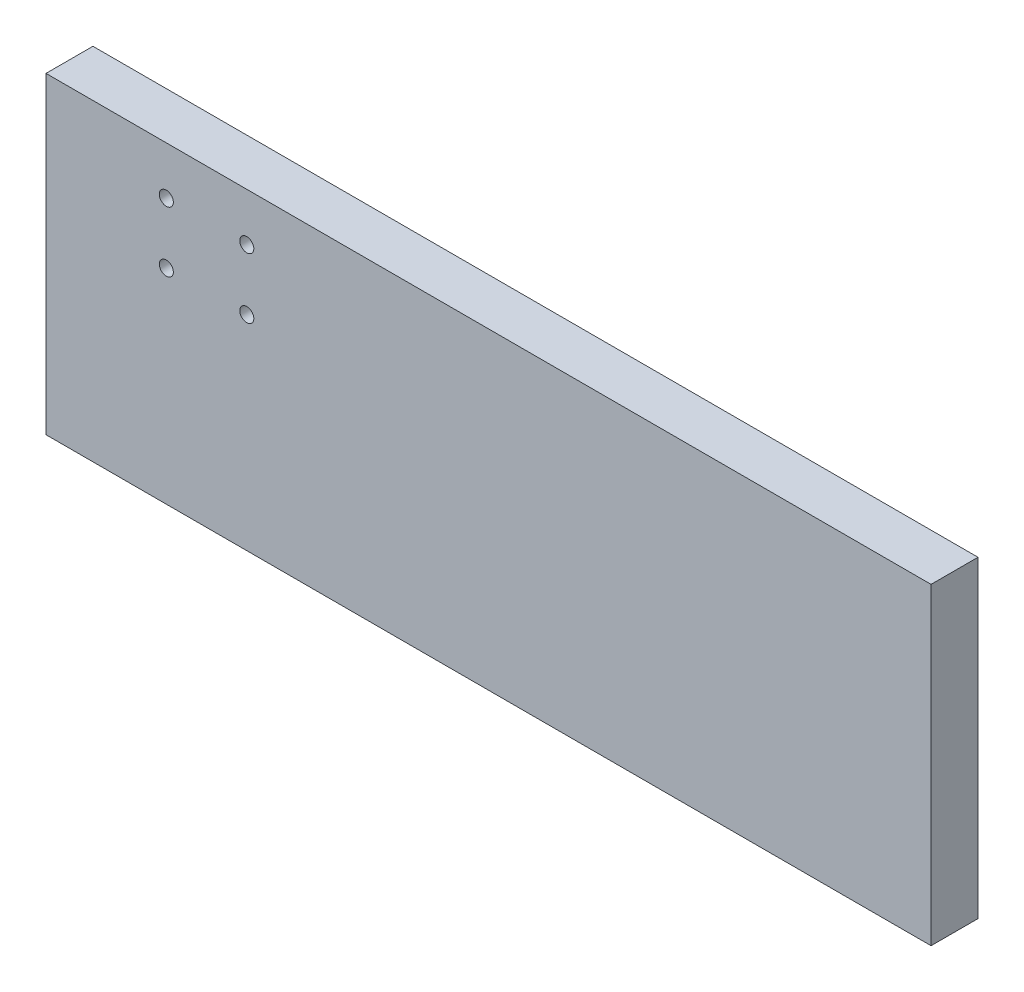
from build123d import *

# Parameters (mm, degrees)
SKETCH1_W           = 359.156
SKETCH1_H           = 127
BOSS_EXTRUDE1_DEPTH = 19.05
CUT_EXTRUDE1_REACH  = 383.425
SKETCH2_R           = 2.85115
SKETCH3_R           = 3.175
CUT_EXTRUDE2_DEPTH  = 6.35


with BuildPart() as part:
    # Sketch1 → Boss-Extrude1 (new body)
    with BuildSketch(Plane.XY):
        with Locations((179.578, 63.5)):
            Rectangle(SKETCH1_W, SKETCH1_H)
    extrude(amount=BOSS_EXTRUDE1_DEPTH)

    # Sketch2 → Cut-Extrude1 (cut, up to next)
    with BuildSketch(Plane.XY.offset(19.05), mode=Mode.PRIVATE) as cut_extrude1_sk1:
        with Locations((48.82515, 82.96275)):
            Circle(SKETCH2_R)
    cut_extrude1_tool1 = extrude(cut_extrude1_sk1.sketch, amount=-CUT_EXTRUDE1_REACH, mode=Mode.PRIVATE) & part.part
    # Sketch2 → Cut-Extrude1 (cut, up to next)
    with BuildSketch(Plane.XY.offset(19.05), mode=Mode.PRIVATE) as cut_extrude1_sk2:
        with Locations((48.82515, 107.53725)):
            Circle(SKETCH2_R)
    cut_extrude1_tool2 = extrude(cut_extrude1_sk2.sketch, amount=-CUT_EXTRUDE1_REACH, mode=Mode.PRIVATE) & part.part
    # Sketch2 → Cut-Extrude1 (cut, up to next)
    with BuildSketch(Plane.XY.offset(19.05), mode=Mode.PRIVATE) as cut_extrude1_sk3:
        with Locations((81.47685, 107.53725)):
            Circle(SKETCH2_R)
    cut_extrude1_tool3 = extrude(cut_extrude1_sk3.sketch, amount=-CUT_EXTRUDE1_REACH, mode=Mode.PRIVATE) & part.part
    # Sketch2 → Cut-Extrude1 (cut, up to next)
    with BuildSketch(Plane.XY.offset(19.05), mode=Mode.PRIVATE) as cut_extrude1_sk4:
        with Locations((81.47685, 82.96275)):
            Circle(SKETCH2_R)
    cut_extrude1_tool4 = extrude(cut_extrude1_sk4.sketch, amount=-CUT_EXTRUDE1_REACH, mode=Mode.PRIVATE) & part.part
    add(cut_extrude1_tool1.solids().sort_by_distance((48.82515, 82.96275, 19.05))[0], mode=Mode.SUBTRACT)
    add(cut_extrude1_tool2.solids().sort_by_distance((48.82515, 107.53725, 19.05))[0], mode=Mode.SUBTRACT)
    add(cut_extrude1_tool3.solids().sort_by_distance((81.47685, 107.53725, 19.05))[0], mode=Mode.SUBTRACT)
    add(cut_extrude1_tool4.solids().sort_by_distance((81.47685, 82.96275, 19.05))[0], mode=Mode.SUBTRACT)

    # Sketch3 → Cut-Extrude2 (cut)
    with BuildSketch(Plane(origin=(0, 0, 0), x_dir=(-1, 0, 0), z_dir=(0, 0, -1))):
        with Locations((-65.151, 117.475)):
            Circle(SKETCH3_R)
    extrude(amount=-CUT_EXTRUDE2_DEPTH, mode=Mode.SUBTRACT)


solid = part.part
